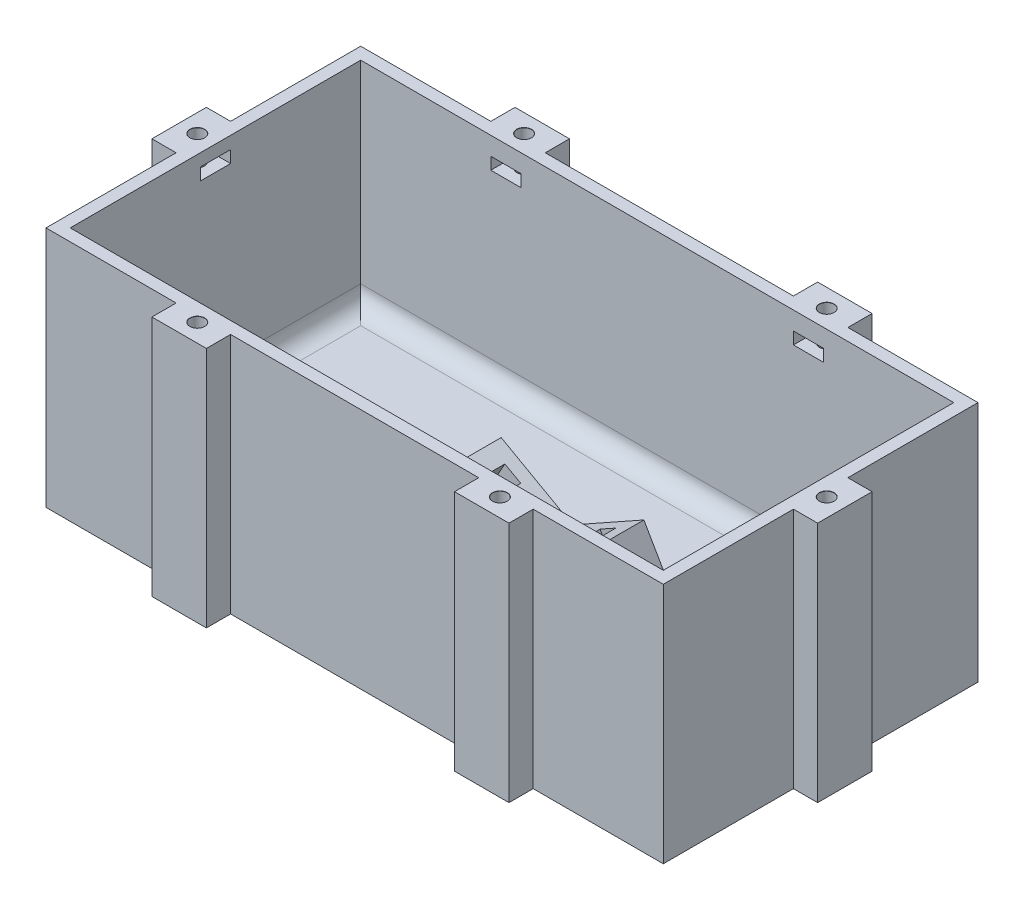
from build123d import *

# Parameters (mm, degrees)
SKIZZE1_W                                  = 110
SKIZZE1_H                                  = 60
AUFSATZ_LINEAR_AUSTRAGEN1_DEPTH            = 40
SKIZZE2_W                                  = 98
SKIZZE2_H                                  = 48
SCHNITT_LINEAR_AUSTRAGEN1_DEPTH            = 35
F_2_4_2_4_DURCHMESSER_BOHRUNG1_D           = 2.4
F_2_4_2_4_DURCHMESSER_BOHRUNG1_DEPTH       = 10
F_2_4_2_4_DURCHMESSER_BOHRUNG1_CSINK_D     = 2.45
F_2_4_2_4_DURCHMESSER_BOHRUNG1_CSINK_ANGLE = 90
F_2_4_2_4_DURCHMESSER_BOHRUNG1_TIP         = 0.721032743
SKIZZE5_W                                  = 5
SKIZZE5_H                                  = 2
SCHNITT_LINEAR_AUSTRAGEN2_DEPTH            = 5
SKIZZE6_W                                  = 5
SKIZZE6_H                                  = 2
SCHNITT_LINEAR_AUSTRAGEN3_DEPTH            = 5
SKIZZE7_W                                  = 5
SKIZZE7_H                                  = 2
SCHNITT_LINEAR_AUSTRAGEN4_DEPTH            = 5
SKIZZE8_W                                  = 5
SKIZZE8_H                                  = 2
SCHNITT_LINEAR_AUSTRAGEN5_DEPTH            = 5
SKIZZE9_W                                  = 15.6
SKIZZE9_H                                  = 20
AUFSATZ_LINEAR_AUSTRAGEN2_DEPTH            = 6.6
SCHNITT_LINEAR_START                       = -20
SCHNITT_LINEAR_AUSTRAGEN11_DEPTH           = 20
SCHNITT_LINEAR_AUSTRAGEN12_DEPTH           = 20
SKIZZE19_W                                 = 30
SKIZZE19_H                                 = 20
SCHNITT_LINEAR_AUSTRAGEN13_DEPTH           = 22.6
SKIZZE20_W                                 = 15.6
SKIZZE20_H                                 = 20
AUFSATZ_LINEAR_AUSTRAGEN4_DEPTH            = 6.6
SCHNITT_LINEAR_AUSTRAGEN14_DEPTH           = 20
SCHNITT_LINEAR_AUSTRAGEN15_DEPTH           = 20
SKIZZE23_W                                 = 30
SKIZZE23_H                                 = 20
SCHNITT_LINEAR_AUSTRAGEN16_DEPTH           = 20.6
SKIZZE24_W                                 = 3
SKIZZE24_H                                 = 6
SCHNITT_LINEAR_AUSTRAGEN17_DEPTH           = 7
SKIZZE25_W                                 = 3
SKIZZE25_H                                 = 6
SCHNITT_LINEAR_AUSTRAGEN18_DEPTH           = 7
F_3_4_3_4_DURCHMESSER_BOHRUNG1_D           = 3.4
F_3_4_3_4_DURCHMESSER_BOHRUNG1_DEPTH       = 10
F_3_4_3_4_DURCHMESSER_BOHRUNG1_CSINK_D     = 3.45
F_3_4_3_4_DURCHMESSER_BOHRUNG1_CSINK_ANGLE = 90
F_3_4_3_4_DURCHMESSER_BOHRUNG1_TIP         = 1.021463052
F_3_4_3_4_DURCHMESSER_BOHRUNG2_D           = 3.4
F_3_4_3_4_DURCHMESSER_BOHRUNG2_DEPTH       = 10
F_3_4_3_4_DURCHMESSER_BOHRUNG2_CSINK_D     = 3.45
F_3_4_3_4_DURCHMESSER_BOHRUNG2_CSINK_ANGLE = 90
F_3_4_3_4_DURCHMESSER_BOHRUNG2_TIP         = 1.021463052
VERRUNDUNG1_R                              = 3
SCHNITT_LINEAR_AUSTRAGEN20_DEPTH           = 132.52946438
SCHNITT_LINEAR_AUSTRAGEN20_DEPTH_BACK      = 132.52946438
SCHNITT_LINEAR_AUSTRAGEN21_DEPTH           = 132.52946438
SCHNITT_LINEAR_AUSTRAGEN21_DEPTH_BACK      = 132.52946438
SCHNITT_LINEAR_AUSTRAGEN22_DEPTH           = 132.52946438
SCHNITT_LINEAR_AUSTRAGEN22_DEPTH_BACK      = 132.52946438
SKIZZE32_W                                 = 41
SKIZZE32_H                                 = 4
SCHNITT_LINEAR_AUSTRAGEN23_DEPTH           = 132.52946438
SCHNITT_LINEAR_AUSTRAGEN23_DEPTH_BACK      = 132.52946438
SCHNITT_LINEAR_AUSTRAGEN24_DEPTH           = 132.52946438
SCHNITT_LINEAR_AUSTRAGEN24_DEPTH_BACK      = 132.52946438
SCHNITT_LINEAR_AUSTRAGEN25_DEPTH           = 132.52946438
SCHNITT_LINEAR_AUSTRAGEN25_DEPTH_BACK      = 132.52946438


# Read off the part's stored shape, not the designer's step: Schnitt-Linear austragen11, Schnitt-Linear austragen12, Schnitt-Linear austragen14, Schnitt-Linear austragen15
with BuildPart() as part:
    # Skizze1 → Aufsatz-Linear austragen1 (new body)
    with BuildSketch(Plane(origin=(0, 0, 0), x_dir=(1, 0, 0), z_dir=(0, 1, 0))):
        with Locations((55, 30)):
            Rectangle(SKIZZE1_W, SKIZZE1_H)
    extrude(amount=AUFSATZ_LINEAR_AUSTRAGEN1_DEPTH)

    # Skizze2 → Schnitt-Linear austragen1 (cut)
    with BuildSketch(Plane(origin=(0, 40, 0), x_dir=(1, 0, 0), z_dir=(0, 1, 0))):
        with Locations((55, 30)):
            Rectangle(SKIZZE2_W, SKIZZE2_H)
    extrude(amount=-SCHNITT_LINEAR_AUSTRAGEN1_DEPTH, mode=Mode.SUBTRACT)

    # Ø2.4 (2.4) Durchmesser Bohrung1
    with Locations(Plane(origin=(0, 40, 0), x_dir=(1, 0, 0), z_dir=(0, 1, 0))):
        with Locations((107, 30), (80, 57), (30, 57), (80, 3), (30, 3), (3, 30), (92.736705005, 121.322283987)):
            CounterSinkHole(F_2_4_2_4_DURCHMESSER_BOHRUNG1_D / 2, F_2_4_2_4_DURCHMESSER_BOHRUNG1_CSINK_D / 2, depth=F_2_4_2_4_DURCHMESSER_BOHRUNG1_DEPTH, counter_sink_angle=F_2_4_2_4_DURCHMESSER_BOHRUNG1_CSINK_ANGLE)
            with Locations((0, 0, -(F_2_4_2_4_DURCHMESSER_BOHRUNG1_DEPTH + F_2_4_2_4_DURCHMESSER_BOHRUNG1_TIP / 2))):  # 118° drill point
                Cone(0, F_2_4_2_4_DURCHMESSER_BOHRUNG1_D / 2, F_2_4_2_4_DURCHMESSER_BOHRUNG1_TIP, mode=Mode.SUBTRACT)

    # Skizze5 → Schnitt-Linear austragen2 (cut)
    with BuildSketch(Plane.XY.offset(-54)):
        with Locations((30, 36)):
            Rectangle(SKIZZE5_W, SKIZZE5_H)
        with Locations((80, 36)):
            Rectangle(SKIZZE5_W, SKIZZE5_H)
    extrude(amount=-SCHNITT_LINEAR_AUSTRAGEN2_DEPTH, mode=Mode.SUBTRACT)

    # Skizze6 → Schnitt-Linear austragen3 (cut)
    with BuildSketch(Plane(origin=(6, 0, 0), x_dir=(0, 0, -1), z_dir=(1, 0, 0))):
        with Locations((30, 36.957381644)):
            Rectangle(SKIZZE6_W, SKIZZE6_H)
    extrude(amount=-SCHNITT_LINEAR_AUSTRAGEN3_DEPTH, mode=Mode.SUBTRACT)

    # Skizze7 → Schnitt-Linear austragen4 (cut)
    with BuildSketch(Plane(origin=(0, 0, -6), x_dir=(-1, 0, 0), z_dir=(0, 0, -1))):
        with Locations((-80, 36)):
            Rectangle(SKIZZE7_W, SKIZZE7_H)
        with Locations((-30, 36)):
            Rectangle(SKIZZE7_W, SKIZZE7_H)
    extrude(amount=-SCHNITT_LINEAR_AUSTRAGEN4_DEPTH, mode=Mode.SUBTRACT)

    # Skizze8 → Schnitt-Linear austragen5 (cut)
    with BuildSketch(Plane.ZY.offset(-104)):
        with Locations((-30, 36)):
            Rectangle(SKIZZE8_W, SKIZZE8_H)
    extrude(amount=-SCHNITT_LINEAR_AUSTRAGEN5_DEPTH, mode=Mode.SUBTRACT)

    # Skizze9 → Aufsatz-Linear austragen2 (add)
    with BuildSketch(Plane(origin=(0, 5, 0), x_dir=(1, 0, 0), z_dir=(0, 1, 0))):
        with Locations((47.2, 30)):
            Rectangle(SKIZZE9_W, SKIZZE9_H)
    extrude(amount=AUFSATZ_LINEAR_AUSTRAGEN2_DEPTH)

    # Schnitt-Linear austragen11 outline → Schnitt-Linear austragen11 (cut)
    with BuildSketch(Plane.XY.offset(-20).offset(SCHNITT_LINEAR_START)):
        Polygon((39.4, 5), (43.210511777, 11.6), (39.4, 11.6), align=None)
    extrude(amount=SCHNITT_LINEAR_AUSTRAGEN11_DEPTH, mode=Mode.SUBTRACT)

    # Schnitt-Linear austragen12 outline → Schnitt-Linear austragen12 (cut)
    with BuildSketch(Plane.XY.offset(-20).offset(SCHNITT_LINEAR_START)):
        Polygon((43.210511777, 11.6), (55, 5), (55, 11.6), align=None)
    extrude(amount=SCHNITT_LINEAR_AUSTRAGEN12_DEPTH, mode=Mode.SUBTRACT)

    # Skizze19 → Schnitt-Linear austragen13 (cut)
    with BuildSketch(Plane(origin=(0, 5, 0), x_dir=(1, 0, 0), z_dir=(0, 1, 0))):
        with Locations((24.4, 30)):
            Rectangle(SKIZZE19_W, SKIZZE19_H)
    extrude(amount=-SCHNITT_LINEAR_AUSTRAGEN13_DEPTH, mode=Mode.SUBTRACT)

    # Skizze20 → Aufsatz-Linear austragen4 (add)
    with BuildSketch(Plane(origin=(0, 5, 0), x_dir=(1, 0, 0), z_dir=(0, 1, 0))):
        with Locations((62.8, 30)):
            Rectangle(SKIZZE20_W, SKIZZE20_H)
    extrude(amount=AUFSATZ_LINEAR_AUSTRAGEN4_DEPTH)

    # Schnitt-Linear austragen14 outline → Schnitt-Linear austragen14 (cut)
    with BuildSketch(Plane.XY.offset(-20).offset(SCHNITT_LINEAR_START)):
        Polygon((70.6, 11.6), (66.789488223, 11.6), (70.6, 5), align=None)
    extrude(amount=SCHNITT_LINEAR_AUSTRAGEN14_DEPTH, mode=Mode.SUBTRACT)

    # Schnitt-Linear austragen15 outline → Schnitt-Linear austragen15 (cut)
    with BuildSketch(Plane.XY.offset(-20).offset(SCHNITT_LINEAR_START)):
        Polygon((55, 5), (66.789488223, 11.6), (55, 11.6), align=None)
    extrude(amount=SCHNITT_LINEAR_AUSTRAGEN15_DEPTH, mode=Mode.SUBTRACT)

    # Skizze23 → Schnitt-Linear austragen16 (cut)
    with BuildSketch(Plane(origin=(0, 5, 0), x_dir=(1, 0, 0), z_dir=(0, 1, 0))):
        with Locations((85.6, 30)):
            Rectangle(SKIZZE23_W, SKIZZE23_H)
    extrude(amount=-SCHNITT_LINEAR_AUSTRAGEN16_DEPTH, mode=Mode.SUBTRACT)

    # Skizze24 → Schnitt-Linear austragen17 (cut)
    with BuildSketch(Plane(origin=(15.255119717, 27.250008219, 0), x_dir=(0.8725726906962074, -0.4884842878242667, 0), z_dir=(0.4884842878242667, 0.8725726906962074, 0))):
        with Locations((36.537894789, 25)):
            Rectangle(SKIZZE24_W, SKIZZE24_H)
        with Locations((36.537894789, 35)):
            Rectangle(SKIZZE24_W, SKIZZE24_H)
    extrude(amount=-SCHNITT_LINEAR_AUSTRAGEN17_DEPTH, mode=Mode.SUBTRACT)

    # Skizze25 → Schnitt-Linear austragen18 (cut)
    with BuildSketch(Plane(origin=(10.992739223, -19.636177214, 0), x_dir=(0.8725726906962058, 0.4884842878242695, 0), z_dir=(-0.48848428782426945, 0.8725726906962057, 0))):
        with Locations((59.445101188, 35)):
            Rectangle(SKIZZE25_W, SKIZZE25_H)
        with Locations((59.445101188, 25)):
            Rectangle(SKIZZE25_W, SKIZZE25_H)
    extrude(amount=-SCHNITT_LINEAR_AUSTRAGEN18_DEPTH, mode=Mode.SUBTRACT)

    # Ø3.4 (3.4) Durchmesser Bohrung1
    with Locations(Plane(origin=(55.115063509, 31.820696754, 0), x_dir=(0, 0, -1), z_dir=(0.866025403784436, 0.5000000000000047, 0))):
        with Locations((35, -27.069872981), (25, -27.069872981)):
            CounterSinkHole(F_3_4_3_4_DURCHMESSER_BOHRUNG1_D / 2, F_3_4_3_4_DURCHMESSER_BOHRUNG1_CSINK_D / 2, depth=F_3_4_3_4_DURCHMESSER_BOHRUNG1_DEPTH, counter_sink_angle=F_3_4_3_4_DURCHMESSER_BOHRUNG1_CSINK_ANGLE)
            with Locations((0, 0, -(F_3_4_3_4_DURCHMESSER_BOHRUNG1_DEPTH + F_3_4_3_4_DURCHMESSER_BOHRUNG1_TIP / 2))):  # 118° drill point
                Cone(0, F_3_4_3_4_DURCHMESSER_BOHRUNG1_D / 2, F_3_4_3_4_DURCHMESSER_BOHRUNG1_TIP, mode=Mode.SUBTRACT)

    # Ø3.4 (3.4) Durchmesser Bohrung2
    with Locations(Plane(origin=(27.384936491, -15.810700455, 0), x_dir=(0, 0, 1), z_dir=(-0.8660254037844397, 0.49999999999999806, 0))):
        with Locations((-35, 27.930127019), (-25, 27.930127019)):
            CounterSinkHole(F_3_4_3_4_DURCHMESSER_BOHRUNG2_D / 2, F_3_4_3_4_DURCHMESSER_BOHRUNG2_CSINK_D / 2, depth=F_3_4_3_4_DURCHMESSER_BOHRUNG2_DEPTH, counter_sink_angle=F_3_4_3_4_DURCHMESSER_BOHRUNG2_CSINK_ANGLE)
            with Locations((0, 0, -(F_3_4_3_4_DURCHMESSER_BOHRUNG2_DEPTH + F_3_4_3_4_DURCHMESSER_BOHRUNG2_TIP / 2))):  # 118° drill point
                Cone(0, F_3_4_3_4_DURCHMESSER_BOHRUNG2_D / 2, F_3_4_3_4_DURCHMESSER_BOHRUNG2_TIP, mode=Mode.SUBTRACT)

    # Verrundung1
    verrundung1_edges = [part.edges().sort_by_distance(p)[0] for p in [
        (6, 5, -30),
        (55, 5, -54),
        (104, 5, -30),
        (55, 5, -6),
    ]]
    fillet(verrundung1_edges, radius=VERRUNDUNG1_R)

    # Skizze30 → Schnitt-Linear austragen20 (cut, two sides: drawn at the far end of the back side and taken through both)
    with BuildSketch(Plane(origin=(0, 40, 0), x_dir=(1, 0, 0), z_dir=(0, 1, 0)).offset(-SCHNITT_LINEAR_AUSTRAGEN20_DEPTH_BACK)):
        Polygon((25.5, 300.566693171), (25.5, 60), (25.5, 56), (4, 56), (4, 34.5), (0, 34.5), (-240.566693171, 34.5), (-580.77937331, 374.712680138), (-314.712680138, 640.77937331), align=None)
    extrude(amount=SCHNITT_LINEAR_AUSTRAGEN20_DEPTH + SCHNITT_LINEAR_AUSTRAGEN20_DEPTH_BACK, mode=Mode.SUBTRACT)

    # Skizze31 → Schnitt-Linear austragen21 (cut, two sides: drawn at the far end of the back side and taken through both)
    with BuildSketch(Plane(origin=(0, 40, 0), x_dir=(1, 0, 0), z_dir=(0, 1, 0)).offset(-SCHNITT_LINEAR_AUSTRAGEN21_DEPTH_BACK)):
        Polygon((25.5, -240.566693171), (25.5, 0), (25.5, 4), (4, 4), (4, 25.5), (0, 25.5), (-240.566693171, 25.5), (-580.77937331, -314.712680138), (-314.712680138, -580.77937331), align=None)
    extrude(amount=SCHNITT_LINEAR_AUSTRAGEN21_DEPTH + SCHNITT_LINEAR_AUSTRAGEN21_DEPTH_BACK, mode=Mode.SUBTRACT)

    # Skizze32 → Schnitt-Linear austragen22 (cut, two sides: drawn at the far end of the back side and taken through both)
    with BuildSketch(Plane(origin=(0, 40, 0), x_dir=(1, 0, 0), z_dir=(0, 1, 0)).offset(-SCHNITT_LINEAR_AUSTRAGEN22_DEPTH_BACK)):
        with Locations((55, 2)):
            Rectangle(SKIZZE32_W, SKIZZE32_H)
    extrude(amount=SCHNITT_LINEAR_AUSTRAGEN22_DEPTH + SCHNITT_LINEAR_AUSTRAGEN22_DEPTH_BACK, mode=Mode.SUBTRACT)

    # Skizze34 → Schnitt-Linear austragen23 (cut, two sides: drawn at the far end of the back side and taken through both)
    with BuildSketch(Plane(origin=(0, 40, 0), x_dir=(1, 0, 0), z_dir=(0, 1, 0)).offset(-SCHNITT_LINEAR_AUSTRAGEN23_DEPTH_BACK)):
        Polygon((84.5, -240.574291843), (84.5, -0.007598672), (84.5, 4), (106, 4), (106, 25.5), (110, 25.5), (350.566693171, 25.5), (690.784231319, -314.707822059), (424.717538148, -580.782113903), align=None)
    extrude(amount=SCHNITT_LINEAR_AUSTRAGEN23_DEPTH + SCHNITT_LINEAR_AUSTRAGEN23_DEPTH_BACK, mode=Mode.SUBTRACT)

    # Skizze35 → Schnitt-Linear austragen24 (cut, two sides: drawn at the far end of the back side and taken through both)
    with BuildSketch(Plane(origin=(0, 40, 0), x_dir=(1, 0, 0), z_dir=(0, 1, 0)).offset(-SCHNITT_LINEAR_AUSTRAGEN24_DEPTH_BACK)):
        Polygon((350.566693171, 34.5), (110, 34.5), (106, 34.5), (106, 56), (84.5, 56), (84.5, 60), (84.5, 300.566693171), (424.712680138, 640.77937331), (690.77937331, 374.712680138), align=None)
    extrude(amount=SCHNITT_LINEAR_AUSTRAGEN24_DEPTH + SCHNITT_LINEAR_AUSTRAGEN24_DEPTH_BACK, mode=Mode.SUBTRACT)

    # Skizze36 → Schnitt-Linear austragen25 (cut, two sides: drawn at the far end of the back side and taken through both)
    with BuildSketch(Plane(origin=(0, 40, 0), x_dir=(1, 0, 0), z_dir=(0, 1, 0)).offset(-SCHNITT_LINEAR_AUSTRAGEN25_DEPTH_BACK)):
        Polygon((75.5, 262.875607582), (75.5, 60), (75.5, 56), (34.5, 56), (34.5, 60), (34.5, 262.875607582), (34.5, 668.626822745), (75.5, 668.626822745), align=None)
    extrude(amount=SCHNITT_LINEAR_AUSTRAGEN25_DEPTH + SCHNITT_LINEAR_AUSTRAGEN25_DEPTH_BACK, mode=Mode.SUBTRACT)


solid = part.part
